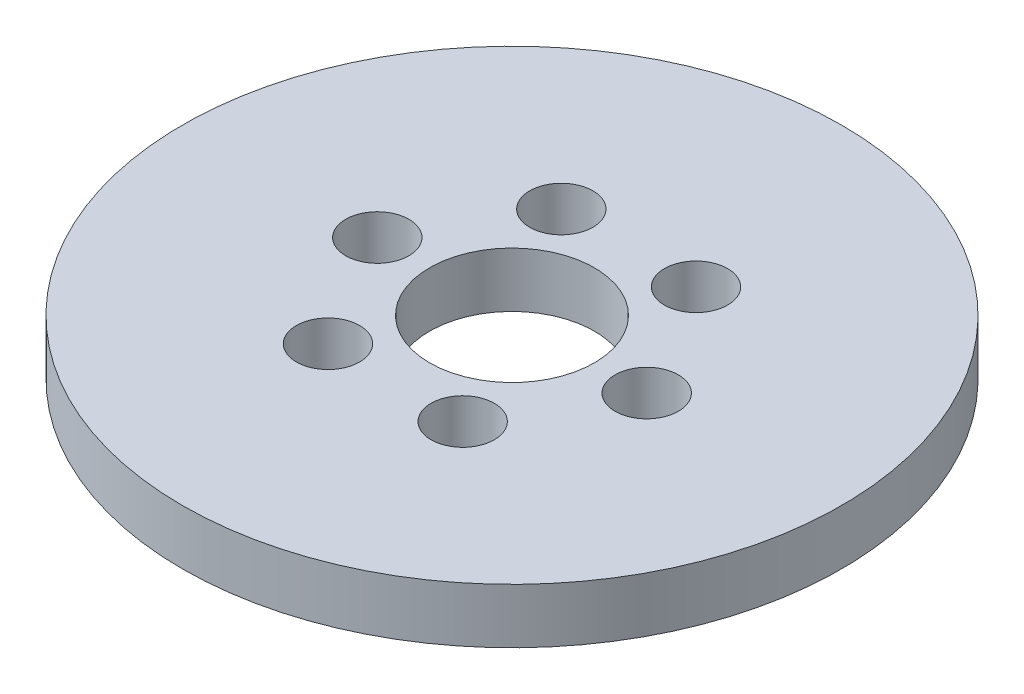
from build123d import *

# Parameters (mm, degrees)
SKETCH1_R           = 60
BOSS_EXTRUDE1_DEPTH = 10
SKETCH2_R           = 15
CUT_EXTRUDE1_DEPTH  = 86.440037453
SKETCH3_R           = 5.757710669
CUT_EXTRUDE2_DEPTH  = 8.773662062
CIRPATTERN1_COUNT   = 6


with BuildPart() as part:
    # Sketch1 → Boss-Extrude1 (new body)
    with BuildSketch(Plane(origin=(0, 0, 0), x_dir=(1, 0, 0), z_dir=(0, 1, 0))):
        Circle(SKETCH1_R)
    extrude(amount=BOSS_EXTRUDE1_DEPTH)

    # Sketch2 → Cut-Extrude1 (cut, through all)
    with BuildSketch(Plane(origin=(0, 0, 0), x_dir=(1, 0, 0), z_dir=(0, 1, 0))):
        Circle(SKETCH2_R)
    extrude(amount=CUT_EXTRUDE1_DEPTH, mode=Mode.SUBTRACT)

    # Sketch3 → Cut-Extrude2 (cut)
    with BuildSketch(Plane(origin=(0, 10, 0), x_dir=(1, 0, 0), z_dir=(0, 1, 0))):
        with Locations((-24.524942952, 0)):
            Circle(SKETCH3_R)
    cut_extrude2 = extrude(amount=-CUT_EXTRUDE2_DEPTH, mode=Mode.SUBTRACT)

    # CirPattern1: Cut-Extrude2 ×6 about axis
    cirpattern1_axis = Axis((0, 0, 0), (0, 1, 0))
    for i in range(1, CIRPATTERN1_COUNT):
        add(cut_extrude2.rotate(cirpattern1_axis, i * 360 / CIRPATTERN1_COUNT), mode=Mode.SUBTRACT)


solid = part.part
